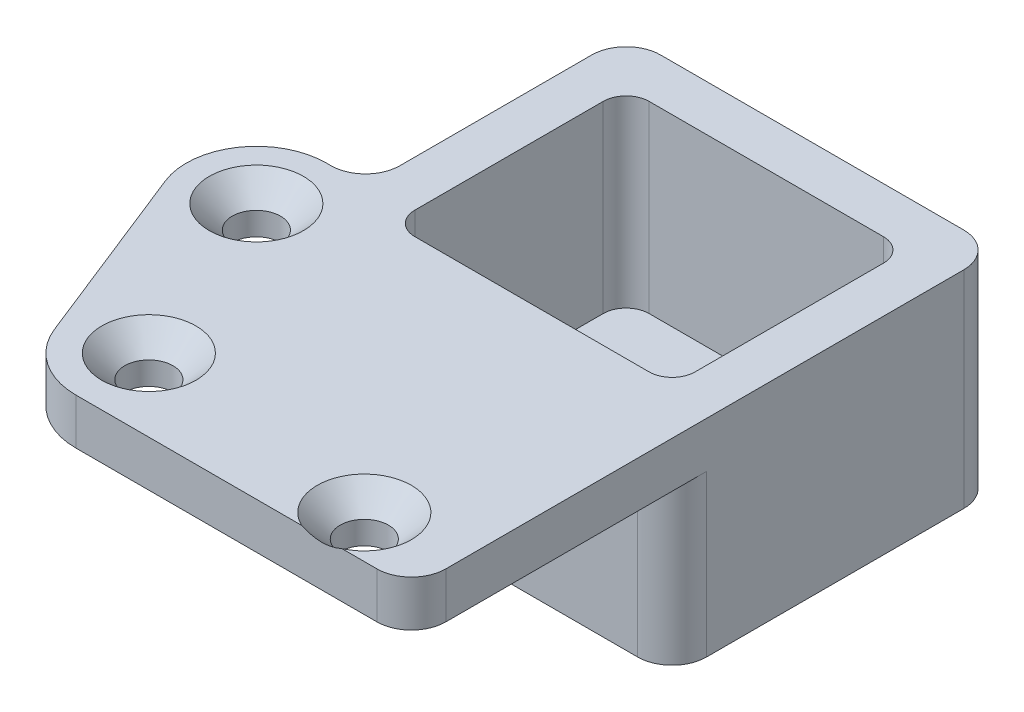
from build123d import *

# Parameters (mm, degrees)
SKETCH1_R           = 1.05
SKETCH1_W           = 12.2
SKETCH1_H           = 10.2
BOSS_EXTRUDE1_DEPTH = 2
SKETCH2_W           = 16.2
SKETCH2_H           = 14.2
SKETCH2_W_2         = 12.2
SKETCH2_H_2         = 10.2
BOSS_EXTRUDE2_DEPTH = 7
SKETCH4_W           = 16.2
SKETCH4_H           = 14.2
SKETCH4_R           = 2
BOSS_EXTRUDE3_DEPTH = 1
FILLET1_R           = 1.5
CUT_EXTRUDE1_DEPTH  = 7
FILLET2_R           = 2
FILLET3_R           = 1
CHAMFER2_SIZE       = 1
SKETCH6_R           = 0.8
CUT_EXTRUDE2_DEPTH  = 1
CHAMFER3_SIZE       = 0.8


with BuildPart() as part:
    # Sketch1 → Boss-Extrude1 (new body)
    with BuildSketch(Plane(origin=(0, 0, 0), x_dir=(1, 0, 0), z_dir=(0, 1, 0))):
        with BuildLine():
            Line((-16.83443407, -1.126269728), (-13.645952788, -9.15058198))
            ThreePointArc((-13.645952788, -9.15058198), (-12.480190316, -10.602941562), (-10.7, -11.15))
            Line((-10.7, -11.15), (3.9, -11.15))
            Line((3.9, -11.15), (3.9, 0.2))
            Line((3.9, 0.2), (3.9, 14.4))
            Line((3.9, 14.4), (-12.3, 14.4))
            Line((-12.3, 14.4), (-12.3, 3.05))
            Line((-12.3, 3.05), (-14, 3.05))
            ThreePointArc((-14, 3.05), (-16.523650399, 1.712801408), (-16.83443407, -1.126269728))
        make_face()
        with Locations(Location((-14, 0, 0), (0, 0, 270))):
            Circle(SKETCH1_R, mode=Mode.SUBTRACT)
        with Locations(Location((0, -9.3, 0), (0, 0, 270))):
            Circle(SKETCH1_R, mode=Mode.SUBTRACT)
        with Locations(Location((-10.7, -7.98, 0), (0, 0, 270))):
            Circle(SKETCH1_R, mode=Mode.SUBTRACT)
        with Locations((-4.2, 7.3)):
            Rectangle(SKETCH1_W, SKETCH1_H, mode=Mode.SUBTRACT)
    extrude(amount=BOSS_EXTRUDE1_DEPTH)

    # Sketch2 → Boss-Extrude2 (add)
    with BuildSketch(Plane.XZ):
        with Locations((-4.2, -7.3)):
            Rectangle(SKETCH2_W, SKETCH2_H)
        with Locations((-4.2, -7.3)):
            Rectangle(SKETCH2_W_2, SKETCH2_H_2, mode=Mode.SUBTRACT)
    extrude(amount=BOSS_EXTRUDE2_DEPTH)

    # Sketch4 → Boss-Extrude3 (add)
    with BuildSketch(Plane.XZ.offset(7)):
        with Locations((-4.2, -7.3)):
            Rectangle(SKETCH4_W, SKETCH4_H)
        with Locations(Location((-4.2, -7.3, 0), (0, 0, 270))):
            Circle(SKETCH4_R, mode=Mode.SUBTRACT)
    extrude(amount=-BOSS_EXTRUDE3_DEPTH)

    # Fillet1
    fillet1_edges = [part.edges().sort_by_distance(p)[0] for p in [
        (-12.3, -2.5, -14.4),
        (3.9, -2.5, -14.4),
        (3.9, 1, 11.15),
        (-12.3, 1, -3.05),
        (3.9, -3.5, -0.2),
        (-12.3, -3.5, -0.2),
    ]]
    fillet(fillet1_edges, radius=FILLET1_R)

    # Sketch5 → Cut-Extrude1 (cut)
    with BuildSketch(Plane.XZ.offset(7)):
        Polygon((-12.3, -2.375849406), (-12.3, -0.2), (-9.840369616, -0.2), align=None)
    extrude(amount=-CUT_EXTRUDE1_DEPTH, mode=Mode.SUBTRACT)

    # Fillet2
    fillet2_edges = [part.edges().sort_by_distance(p)[0] for p in [
        (-12.3, -3.5, -2.375849406),
        (-9.840369616, -3.5, -0.2),
    ]]
    fillet(fillet2_edges, radius=FILLET2_R)

    # Fillet3
    fillet3_edges = [part.edges().sort_by_distance(p)[0] for p in [
        (1.9, -2, -2.2),
        (1.9, -2, -12.4),
        (-10.3, -2, -12.4),
        (-10.3, -2, -2.2),
    ]]
    fillet(fillet3_edges, radius=FILLET3_R)

    # Chamfer2
    # the kernel refuses this chamfer: 1 mm, written as the material it takes off along each edge
    with BuildSketch(Plane(origin=(-14, 2, 0), x_dir=(0, 0, 1), z_dir=(-1, 0, 0))) as chamfer2_piece_1:
        Polygon((1.05 + CHAMFER2_SIZE, 0), (1.05, -CHAMFER2_SIZE), (1.05, 0), align=None)
    revolve(axis=Axis((-14, 2, 0), (0, 1, 0)), mode=Mode.SUBTRACT)
    with BuildSketch(Plane(origin=(0, 2, 9.3), x_dir=(0, 0, 1), z_dir=(-1, 0, 0))) as chamfer2_piece_2:
        Polygon((1.05 + CHAMFER2_SIZE, 0), (1.05, -CHAMFER2_SIZE), (1.05, 0), align=None)
    revolve(axis=Axis((0, 2, 9.3), (0, 1, 0)), mode=Mode.SUBTRACT)
    with BuildSketch(Plane(origin=(-10.7, 2, 7.98), x_dir=(0, 0, 1), z_dir=(-1, 0, 0))) as chamfer2_piece_3:
        Polygon((1.05 + CHAMFER2_SIZE, 0), (1.05, -CHAMFER2_SIZE), (1.05, 0), align=None)
    revolve(axis=Axis((-10.7, 2, 7.98), (0, 1, 0)), mode=Mode.SUBTRACT)

    # Sketch6 → Cut-Extrude2 (cut)
    with BuildSketch(Plane.XZ.offset(7)):
        with Locations(Location((-9.2, -7.3, 0), (0, 0, 270))):
            Circle(SKETCH6_R)
        with Locations(Location((0.8, -7.3, 0), (0, 0, 270))):
            Circle(SKETCH6_R)
    extrude(amount=-CUT_EXTRUDE2_DEPTH, mode=Mode.SUBTRACT)

    # Chamfer3
    chamfer3_edges = [part.edges().sort_by_distance(p)[0] for p in [
        (-9.2, -7, -6.5),
        (0.8, -7, -6.5),
    ]]
    chamfer(chamfer3_edges, length=CHAMFER3_SIZE)


solid = part.part
